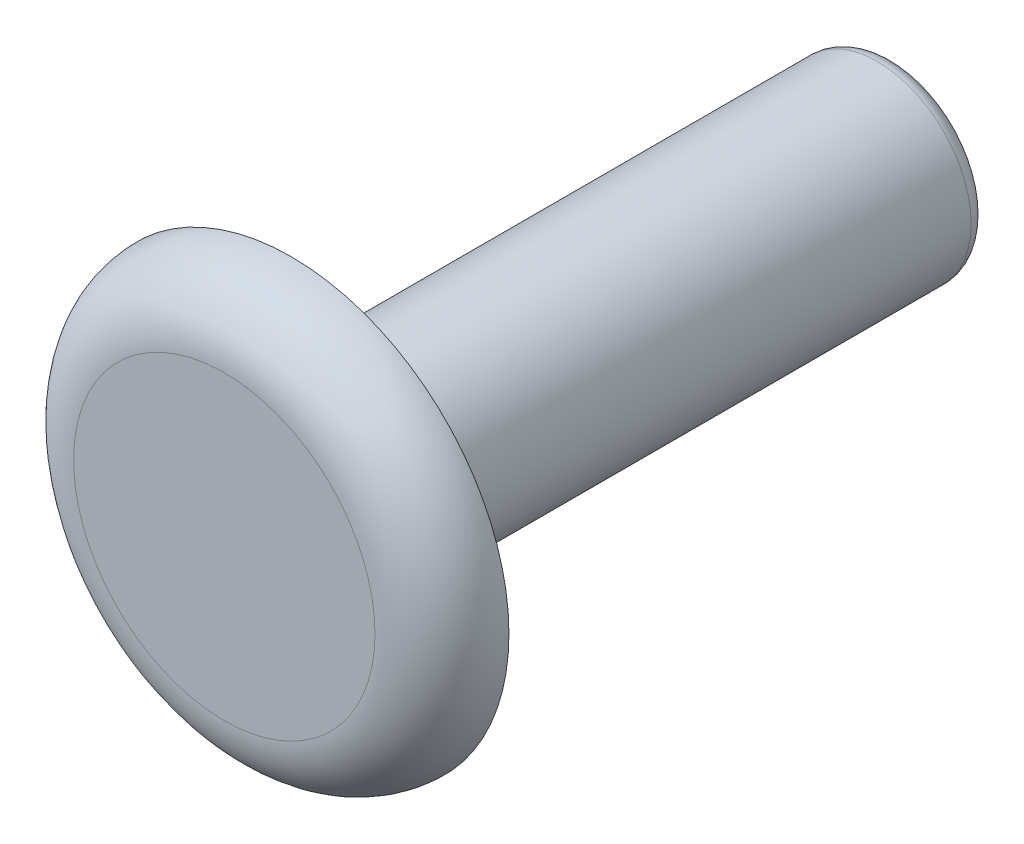
from build123d import *

# Parameters (mm, degrees)
ESQUISSE1_R        = 1.4
BOSS_EXTRU_1_DEPTH = 9
ESQUISSE2_R        = 3.25
BOSS_EXTRU_2_DEPTH = 1
CONG_1_R           = 1
CONG_2_R           = 0.25


with BuildPart() as part:
    # Esquisse1 → Boss.-Extru.1 (new body)
    with BuildSketch(Plane.XY):
        with Locations((-28.068256791, 21.884700983)):
            Circle(ESQUISSE1_R)
    extrude(amount=BOSS_EXTRU_1_DEPTH)

    # Esquisse2 → Boss.-Extru.2 (add)
    with BuildSketch(Plane.XY.offset(9)):
        with Locations((-28.068256791, 21.884700983)):
            Circle(ESQUISSE2_R)
    extrude(amount=BOSS_EXTRU_2_DEPTH)

    # Congé1
    cong_1_edges = [part.edges().sort_by_distance(p)[0] for p in [
        (-31.318256791, 21.884700983, 10),
    ]]
    fillet(cong_1_edges, radius=CONG_1_R - 0.0001)  # a hair under: the kernel refuses the full size

    # Congé2
    cong_2_edges = [part.edges().sort_by_distance(p)[0] for p in [
        (-29.468256791, 21.884700983, 0),
    ]]
    fillet(cong_2_edges, radius=CONG_2_R)


solid = part.part
